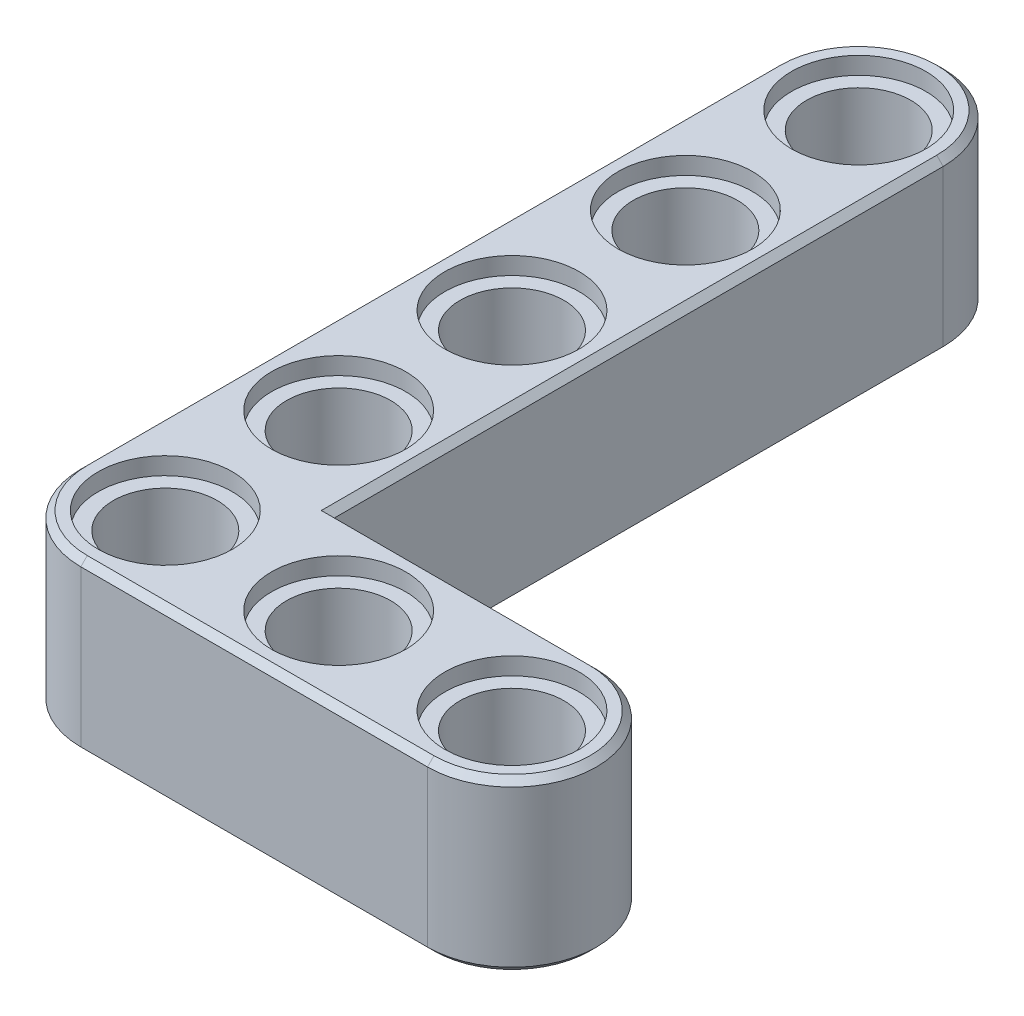
from build123d import *

# Parameters (mm, degrees)
BOSS_EXTRUDE1_DEPTH       = 3.9
FILLET1_R                 = 3.9
SKETCH2_R                 = 2.4
CUT_EXTRUDE2_DEPTH        = 42.781096204
SKETCH4_R                 = 3.1
CUT_EXTRUDE3_DEPTH        = 0.8
LPATTERN1_COUNT           = 5
LPATTERN1_PITCH           = 8
LPATTERN1_COPY_1_SKETCH_R = 3.1
LPATTERN1_COPY_1_DEPTH    = 0.8
LPATTERN1_COPY_2_SKETCH_R = 3.1
LPATTERN1_COPY_2_DEPTH    = 0.8
LPATTERN1_COPY_3_SKETCH_R = 3.1
LPATTERN1_COPY_3_DEPTH    = 0.8
LPATTERN1_COPY_4_SKETCH_R = 3.1
LPATTERN1_COPY_4_DEPTH    = 0.8
LPATTERN2_COUNT           = 3
LPATTERN2_PITCH           = 8
LPATTERN2_COPY_1_SKETCH_R = 3.1
LPATTERN2_COPY_1_DEPTH    = 0.8
LPATTERN2_COPY_2_SKETCH_R = 3.1
LPATTERN2_COPY_2_DEPTH    = 0.8
CHAMFER1_SIZE             = 0.3


with BuildPart() as part:
    # Sketch1 → Boss-Extrude1 (new, symmetric)
    with BuildSketch(Plane(origin=(0, 0, 0), x_dir=(1, 0, 0), z_dir=(0, 1, 0))):
        with BuildLine():
            Line((3.9, 3.9), (16, 3.9))
            ThreePointArc((16, 3.9), (19.9, 0), (16, -3.9))
            Line((16, -3.9), (-3.9, -3.9))
            Line((-3.9, -3.9), (-3.9, 32))
            ThreePointArc((-3.9, 32), (0, 35.9), (3.9, 32))
            Line((3.9, 32), (3.9, 3.9))
        make_face()
    extrude(amount=BOSS_EXTRUDE1_DEPTH, both=True)

    # Fillet1
    fillet1_edges = [part.edges().sort_by_distance(p)[0] for p in [
        (-3.9, 0, 3.9),
    ]]
    fillet(fillet1_edges, radius=FILLET1_R)

    # Sketch2 → Cut-Extrude2 (cut, through all)
    with BuildSketch(Plane(origin=(0, 3.9, 0), x_dir=(1, 0, 0), z_dir=(0, 1, 0))):
        Circle(SKETCH2_R)
    cut_extrude2 = extrude(amount=-CUT_EXTRUDE2_DEPTH, mode=Mode.SUBTRACT)

    # Sketch4 → Cut-Extrude3 (cut)
    with BuildSketch(Plane(origin=(0, 3.9, 0), x_dir=(1, 0, 0), z_dir=(0, 1, 0))):
        Circle(SKETCH4_R)
    cut_extrude3 = extrude(amount=-CUT_EXTRUDE3_DEPTH, mode=Mode.SUBTRACT)

    # Mirror1: Cut-Extrude3 across plane
    add(cut_extrude3.mirror(Plane.ZX), mode=Mode.SUBTRACT)

    # LPattern1: Cut-Extrude2, Cut-Extrude3 ×5
    with Locations(*[(0, 0, -i * LPATTERN1_PITCH) for i in range(1, LPATTERN1_COUNT)]):
        add(cut_extrude2, mode=Mode.SUBTRACT)
        add(cut_extrude3, mode=Mode.SUBTRACT)

    # LPattern1 copy 1 sketch → LPattern1 copy 1 (cut)
    with BuildSketch(Plane(origin=(0, -3.9, -8), x_dir=(1, 0, 0), z_dir=(0, -1, 0))):
        Circle(LPATTERN1_COPY_1_SKETCH_R)
    extrude(amount=-LPATTERN1_COPY_1_DEPTH, mode=Mode.SUBTRACT)

    # LPattern1 copy 2 sketch → LPattern1 copy 2 (cut)
    with BuildSketch(Plane(origin=(0, -3.9, -16), x_dir=(1, 0, 0), z_dir=(0, -1, 0))):
        Circle(LPATTERN1_COPY_2_SKETCH_R)
    extrude(amount=-LPATTERN1_COPY_2_DEPTH, mode=Mode.SUBTRACT)

    # LPattern1 copy 3 sketch → LPattern1 copy 3 (cut)
    with BuildSketch(Plane(origin=(0, -3.9, -24), x_dir=(1, 0, 0), z_dir=(0, -1, 0))):
        Circle(LPATTERN1_COPY_3_SKETCH_R)
    extrude(amount=-LPATTERN1_COPY_3_DEPTH, mode=Mode.SUBTRACT)

    # LPattern1 copy 4 sketch → LPattern1 copy 4 (cut)
    with BuildSketch(Plane(origin=(0, -3.9, -32), x_dir=(1, 0, 0), z_dir=(0, -1, 0))):
        Circle(LPATTERN1_COPY_4_SKETCH_R)
    extrude(amount=-LPATTERN1_COPY_4_DEPTH, mode=Mode.SUBTRACT)

    # LPattern2: Cut-Extrude2, Cut-Extrude3 ×3
    with Locations(*[(i * LPATTERN2_PITCH, 0, 0) for i in range(1, LPATTERN2_COUNT)]):
        add(cut_extrude2, mode=Mode.SUBTRACT)
        add(cut_extrude3, mode=Mode.SUBTRACT)

    # LPattern2 copy 1 sketch → LPattern2 copy 1 (cut)
    with BuildSketch(Plane(origin=(8, -3.9, 0), x_dir=(1, 0, 0), z_dir=(0, -1, 0))):
        Circle(LPATTERN2_COPY_1_SKETCH_R)
    extrude(amount=-LPATTERN2_COPY_1_DEPTH, mode=Mode.SUBTRACT)

    # LPattern2 copy 2 sketch → LPattern2 copy 2 (cut)
    with BuildSketch(Plane(origin=(16, -3.9, 0), x_dir=(1, 0, 0), z_dir=(0, -1, 0))):
        Circle(LPATTERN2_COPY_2_SKETCH_R)
    extrude(amount=-LPATTERN2_COPY_2_DEPTH, mode=Mode.SUBTRACT)

    # Chamfer1
    chamfer1_edges = [part.edges().sort_by_distance(p)[0] for p in [
        (9.95, 3.9, -3.9),
        (19.9, 3.9, 0),
        (3.9, 3.9, -17.95),
        (8, 3.9, 3.9),
        (0, 3.9, -35.9),
        (-2.757716447, 3.9, 2.757716447),
        (-3.9, 3.9, -16),
        (3.9, -3.9, -17.95),
        (0, -3.9, -35.9),
        (-3.9, -3.9, -16),
        (9.95, -3.9, -3.9),
        (-2.757716447, -3.9, 2.757716447),
        (19.9, -3.9, 0),
        (8, -3.9, 3.9),
    ]]
    chamfer(chamfer1_edges, length=CHAMFER1_SIZE)


solid = part.part
